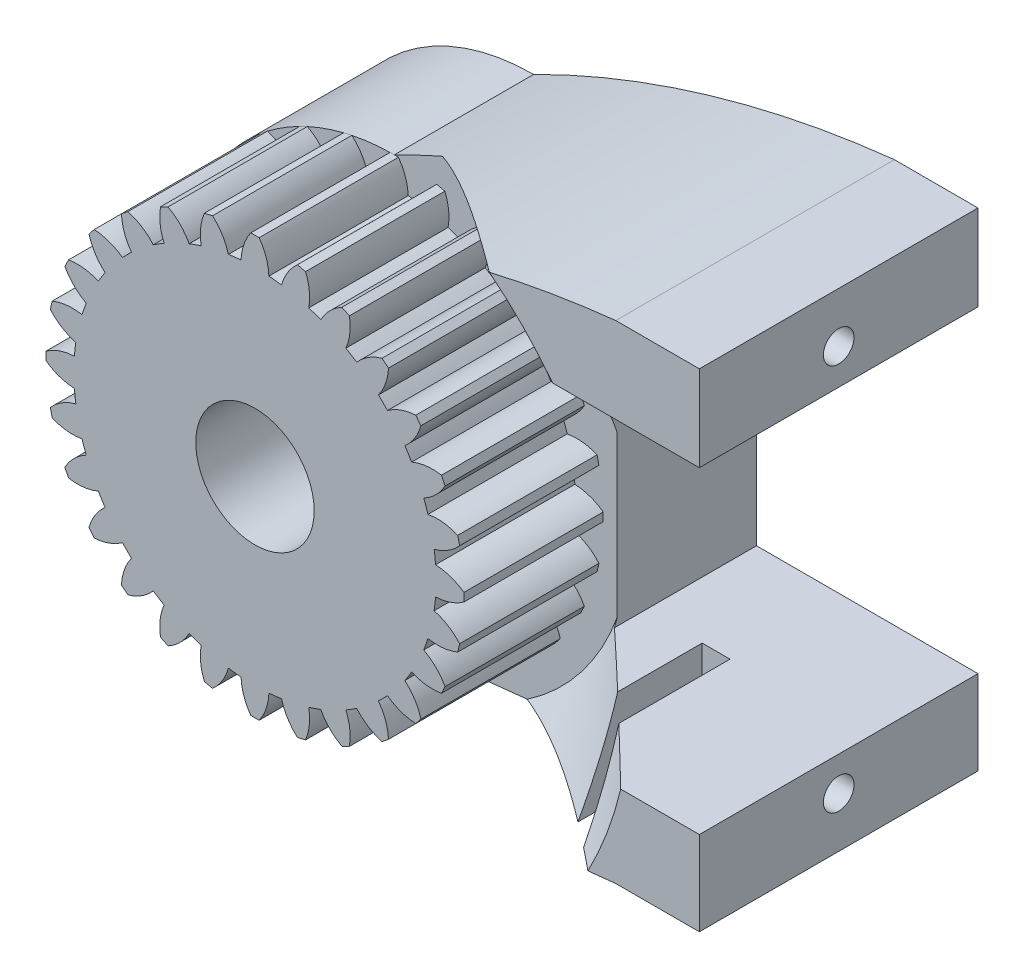
from build123d import *

# Parameters (mm, degrees)
SKETCH2_R           = 13
SKETCH2_R_2         = 4.25
BOSS_EXTRUDE1_DEPTH = 10
BOSS_EXTRUDE2_DEPTH = 10
CIRPATTERN1_COUNT   = 28
SKETCH3_R           = 15
SKETCH3_R_2         = 7.5
BOSS_EXTRUDE3_DEPTH = 10
SKETCH5_R           = 7.5
SKETCH5_R_2         = 4.25
BOSS_EXTRUDE4_DEPTH = 5
BOSS_EXTRUDE7_START = -10
SKETCH6_W           = 6
SKETCH6_H           = 6.15
SKETCH6_H_2         = 6.05
BOSS_EXTRUDE7_DEPTH = 10
BOSS_EXTRUDE8_START = 10
BOSS_EXTRUDE8_DEPTH = 10
CHAMFER1_SIZE       = 10
SKETCH13_W          = 86.660941352
SKETCH13_H          = 57.835950129
CUT_EXTRUDE1_DEPTH  = 20
SKETCH14_R          = 1.1
CUT_EXTRUDE2_DEPTH  = 2
SKETCH15_W          = 2
SKETCH15_H          = 12.8514596
CUT_EXTRUDE3_DEPTH  = 48.494341938
SKETCH16_R          = 9.5
CUT_EXTRUDE4_DEPTH  = 5


with BuildPart() as part:
    # Sketch2 → Boss-Extrude1 (new body)
    with BuildSketch(Plane.XY):
        Circle(SKETCH2_R)
        Circle(SKETCH2_R_2, mode=Mode.SUBTRACT)
    extrude(amount=BOSS_EXTRUDE1_DEPTH)

    # Sketch2<3> → Boss-Extrude2 (add)
    with BuildSketch(Plane.XY):
        with BuildLine():
            ThreePointArc((1, 12.961481397), (0.8, 14.03224869), (0.3, 15))
            Line((0.3, 15), (-0.3, 15))
            ThreePointArc((-0.3, 15), (-0.8, 14.03224869), (-1, 12.961481397))
            ThreePointArc((-1, 12.961481397), (0, 13), (1, 12.961481397))
        make_face()
    boss_extrude2 = extrude(amount=BOSS_EXTRUDE2_DEPTH)

    # CirPattern1: Boss-Extrude2 ×28 about axis
    cirpattern1_axis = Axis((0, 0, 0), (0, 0, 1))
    for i in range(1, CIRPATTERN1_COUNT):
        add(boss_extrude2.rotate(cirpattern1_axis, i * 360 / CIRPATTERN1_COUNT))

    # Sketch3 → Boss-Extrude3 (add)
    with BuildSketch(Plane.XY.offset(10)):
        Circle(SKETCH3_R)
        Circle(SKETCH3_R_2, mode=Mode.SUBTRACT)
    extrude(amount=BOSS_EXTRUDE3_DEPTH)

    # Sketch5 → Boss-Extrude4 (add)
    with BuildSketch(Plane.XY.offset(10)):
        Circle(SKETCH5_R)
        Circle(SKETCH5_R_2, mode=Mode.SUBTRACT)
    extrude(amount=BOSS_EXTRUDE4_DEPTH)

    # Sketch6 → Boss-Extrude7 (add)
    with BuildSketch(Plane.XY.offset(20).offset(BOSS_EXTRUDE7_START)):
        with BuildLine():
            Line((16, 16.5), (25.9, 16.5))
            Line((25.9, 16.5), (25.9, 22.65))
            ThreePointArc((25.9, 22.65), (12.602835008, 20.000369059), (0, 15))
            ThreePointArc((0, 15), (10.606601718, 10.606601718), (15, 0))
            ThreePointArc((15, 0), (14.649111295, -3.225451636), (13.612861565, -6.3))
            Line((13.612861565, -6.3), (16, -6.3))
            Line((16, -6.3), (16, 16.5))
        make_face()
        with Locations((28.9, 19.575)):
            Rectangle(SKETCH6_W, SKETCH6_H)
        with BuildLine():
            Line((25.9, -12.35), (25.9, -6.3))
            Line((25.9, -6.3), (16, -6.3))
            Line((16, -6.3), (13.612861565, -6.3))
            ThreePointArc((13.612861565, -6.3), (8.928692734, -12.053150877), (2.060359996, -14.857823417))
            Line((2.060359996, -14.857823417), (25.9, -12.35))
        make_face()
        with Locations((28.9, -9.325)):
            Rectangle(SKETCH6_W, SKETCH6_H_2)
    extrude(amount=BOSS_EXTRUDE7_DEPTH)

    # Sketch12 → Boss-Extrude8 (add)
    with BuildSketch(Plane(origin=(0, 0, 10), x_dir=(-1, 0, 0), z_dir=(0, 0, -1)).offset(BOSS_EXTRUDE8_START)):
        with BuildLine():
            ThreePointArc((-3.465909745, 16.642940535), (-14.449027089, 20.520101874), (-25.9, 22.65))
            Line((-25.9, 22.65), (-31.9, 22.65))
            Line((-31.9, 22.65), (-31.9, 16.5))
            Line((-31.9, 16.5), (-16, 16.5))
            Line((-16, 16.5), (-16, 5.744562647))
            ThreePointArc((-16, 5.744562647), (-11.15455381, 12.828715029), (-3.465909745, 16.642940535))
        make_face()
        with BuildLine():
            Line((-25.9, -12.35), (-9.539714233, -14.07102883))
            ThreePointArc((-9.539714233, -14.07102883), (-13.431372252, -10.421047905), (-16, -5.744562647))
            Line((-16, -5.744562647), (-16, -6.3))
            Line((-16, -6.3), (-31.9, -6.3))
            Line((-31.9, -6.3), (-31.9, -12.35))
            Line((-31.9, -12.35), (-25.9, -12.35))
        make_face()
    extrude(amount=-BOSS_EXTRUDE8_DEPTH)

    # Chamfer1
    chamfer1_edges = [part.edges().sort_by_distance(p)[0] for p in [
        (13.431372252, -10.421047905, 0),
        (11.15455381, 12.828715029, 0),
    ]]
    chamfer(chamfer1_edges, length=CHAMFER1_SIZE - 0.0001)  # a hair under: the kernel refuses the full size

    # Mirror1: part across plane


with BuildPart() as part_1:
    add(part.part)
    add(part.part.mirror(Plane.XY))

    # Sketch13 → Cut-Extrude1 (cut)
    with BuildSketch(Plane.XY.offset(20)):
        with Locations((5.557004635, 1.637850166)):
            Rectangle(SKETCH13_W, SKETCH13_H)
    extrude(amount=-CUT_EXTRUDE1_DEPTH, mode=Mode.SUBTRACT)

    # Sketch14 → Cut-Extrude2 (cut)
    with BuildSketch(Plane(origin=(31.9, 0, 0), x_dir=(0, 0, -1), z_dir=(1, 0, 0))):
        with Locations((10, 19.05)):
            Circle(SKETCH14_R)
        with Locations(Location((10, -8.75, 0), (0, 0, 180))):
            Circle(SKETCH14_R)
    extrude(amount=-CUT_EXTRUDE2_DEPTH, mode=Mode.SUBTRACT)

    # Sketch15 → Cut-Extrude3 (cut, through all)
    with BuildSketch(Plane(origin=(0, -6.3, 0), x_dir=(1, 0, 0), z_dir=(0, 1, 0))):
        with Locations((21.1, 5.5742702)):
            Rectangle(SKETCH15_W, SKETCH15_H)
    extrude(amount=-CUT_EXTRUDE3_DEPTH, mode=Mode.SUBTRACT)

    # Sketch16 → Cut-Extrude4 (cut)
    with BuildSketch(Plane(origin=(0, 0, -20), x_dir=(-1, 0, 0), z_dir=(0, 0, -1))):
        Circle(SKETCH16_R)
    extrude(amount=-CUT_EXTRUDE4_DEPTH, mode=Mode.SUBTRACT)


solid = part_1.part
